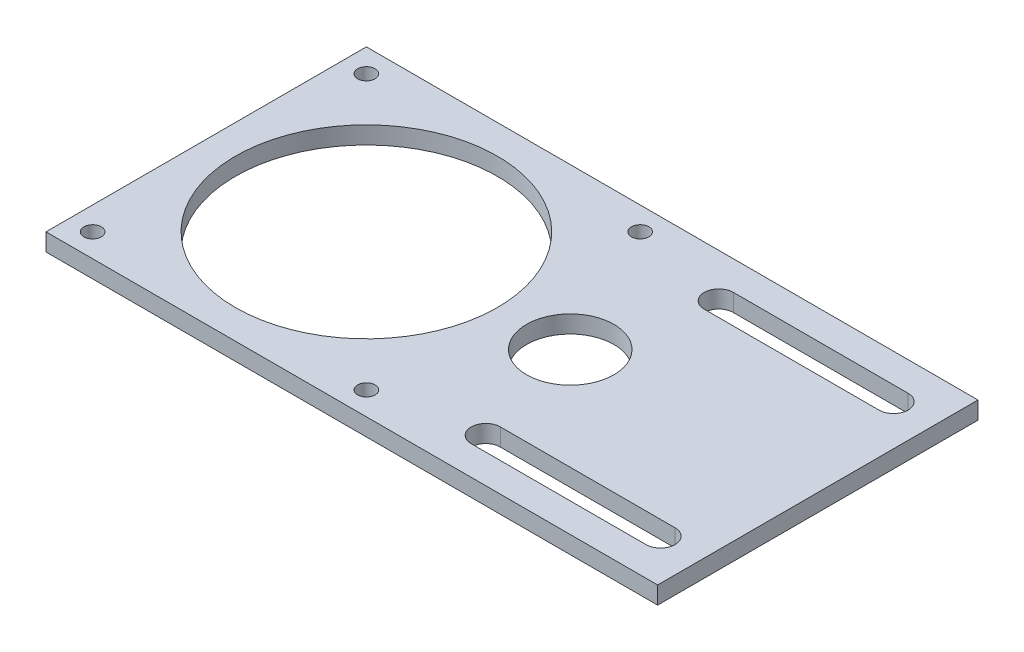
from build123d import *

# Parameters (mm, degrees)
SKETCH1_W           = 105
SKETCH1_H           = 55
SKETCH1_R           = 22.5
SKETCH1_R_2         = 7.5
SKETCH1_R_3         = 1.5
BOSS_EXTRUDE1_DEPTH = 3


with BuildPart() as part:
    # Sketch1 → Boss-Extrude1 (new body)
    with BuildSketch(Plane(origin=(0, 0, 0), x_dir=(1, 0, 0), z_dir=(0, 1, 0))):
        with Locations((52.5, 27.5)):
            Rectangle(SKETCH1_W, SKETCH1_H)
        with Locations((27.5, 27.5)):
            Circle(SKETCH1_R, mode=Mode.SUBTRACT)
        with Locations((62.5, 27.5)):
            Circle(SKETCH1_R_2, mode=Mode.SUBTRACT)
        with Locations((4, 4)):
            Circle(SKETCH1_R_3, mode=Mode.SUBTRACT)
        with Locations((51, 4)):
            Circle(SKETCH1_R_3, mode=Mode.SUBTRACT)
        with Locations((51, 51)):
            Circle(SKETCH1_R_3, mode=Mode.SUBTRACT)
        with Locations((4, 51)):
            Circle(SKETCH1_R_3, mode=Mode.SUBTRACT)
        with BuildLine():
            Line((98, 45), (68, 45))
            ThreePointArc((68, 45), (65.5, 47.5), (68, 50))
            Line((68, 50), (98, 50))
            ThreePointArc((98, 50), (100.5, 47.5), (98, 45))
        make_face(mode=Mode.SUBTRACT)
        with BuildLine():
            Line((98, 5), (68, 5))
            ThreePointArc((68, 5), (65.5, 7.5), (68, 10))
            Line((68, 10), (98, 10))
            ThreePointArc((98, 10), (100.5, 7.5), (98, 5))
        make_face(mode=Mode.SUBTRACT)
    extrude(amount=BOSS_EXTRUDE1_DEPTH)


solid = part.part
